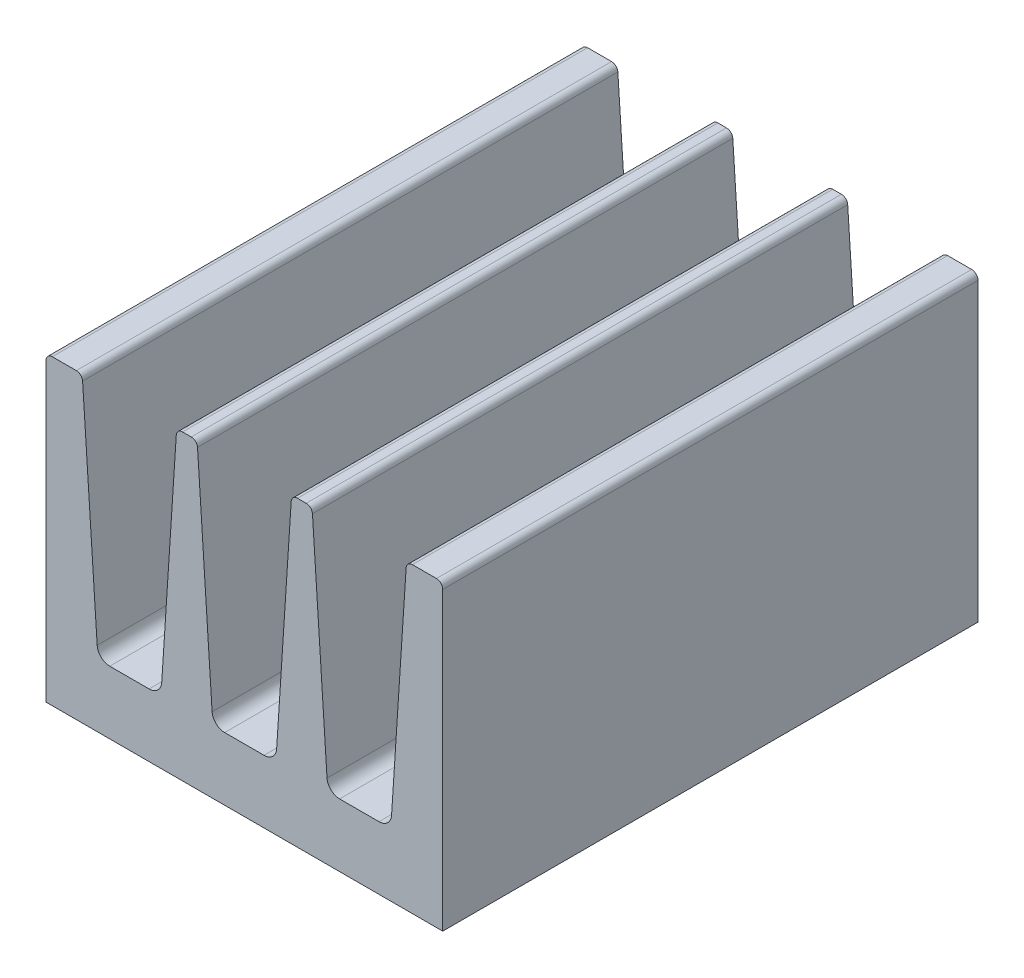
from build123d import *
from OCP.BRepFilletAPI import BRepFilletAPI_MakeChamfer

# Parameters (mm, degrees)
SKETCH1_W           = 6.3
SKETCH1_H           = 8.5
BOSS_EXTRUDE1_DEPTH = 4.8
SKETCH2_W           = 1
SKETCH2_H           = 8.5
CUT_EXTRUDE1_DEPTH  = 3.8
CHAMFER1_SIZE       = 3.8
CHAMFER1_SIZE_2     = 0.25
FILLET1_R           = 0.2
FILLET2_R           = 0.1


with BuildPart() as part:
    # Sketch1 → Boss-Extrude1 (new body)
    with BuildSketch(Plane(origin=(0, 0, 0), x_dir=(1, 0, 0), z_dir=(0, 1, 0))):
        with Locations((3.15, 4.25)):
            Rectangle(SKETCH1_W, SKETCH1_H)
    extrude(amount=BOSS_EXTRUDE1_DEPTH)

    # Sketch2 → Cut-Extrude1 (cut)
    with BuildSketch(Plane(origin=(0, 4.8, 0), x_dir=(1, 0, 0), z_dir=(0, 1, 0))):
        with Locations((1.325, 4.25)):
            Rectangle(SKETCH2_W, SKETCH2_H)
        with Locations((3.15, 4.25)):
            Rectangle(SKETCH2_W, SKETCH2_H)
        with Locations((4.975, 4.25)):
            Rectangle(SKETCH2_W, SKETCH2_H)
    extrude(amount=-CUT_EXTRUDE1_DEPTH, mode=Mode.SUBTRACT)

    # Chamfer1
    chamfer1_edges_1 = [part.edges().sort_by_distance(p)[0] for p in [
        (0.825, 4.8, -4.25),
    ]]
    chamfer1_side_1 = [part.faces().sort_by_distance(p)[0] for p in [
        (0.825, 4.795, -4.25),
    ]]
    chamfer1_edges_2 = [part.edges().sort_by_distance(p)[0] for p in [
        (5.475, 4.8, -4.25),
    ]]
    chamfer1_side_2 = [part.faces().sort_by_distance(p)[0] for p in [
        (5.48, 4.8, -4.25),
    ]]
    chamfer1_edges_3 = [part.edges().sort_by_distance(p)[0] for p in [
        (4.475, 4.8, -4.25),
    ]]
    chamfer1_side_3 = [part.faces().sort_by_distance(p)[0] for p in [
        (4.475, 4.795, -4.25),
    ]]
    chamfer1_edges_4 = [part.edges().sort_by_distance(p)[0] for p in [
        (3.65, 4.8, -4.25),
    ]]
    chamfer1_side_4 = [part.faces().sort_by_distance(p)[0] for p in [
        (3.655, 4.8, -4.25),
    ]]
    chamfer1_edges_5 = [part.edges().sort_by_distance(p)[0] for p in [
        (2.65, 4.8, -4.25),
    ]]
    chamfer1_side_5 = [part.faces().sort_by_distance(p)[0] for p in [
        (2.65, 4.795, -4.25),
    ]]
    chamfer1_edges_6 = [part.edges().sort_by_distance(p)[0] for p in [
        (1.825, 4.8, -4.25),
    ]]
    chamfer1_side_6 = [part.faces().sort_by_distance(p)[0] for p in [
        (1.83, 4.8, -4.25),
    ]]
    chamfer1 = BRepFilletAPI_MakeChamfer(part.part.solid().wrapped)
    for e in chamfer1_edges_1:
        chamfer1.Add(CHAMFER1_SIZE - 0.0001, CHAMFER1_SIZE_2 - 0.0001, e.wrapped, chamfer1_side_1[0].wrapped)
    for e in chamfer1_edges_2:
        chamfer1.Add(CHAMFER1_SIZE_2 - 0.0001, CHAMFER1_SIZE - 0.0001, e.wrapped, chamfer1_side_2[0].wrapped)
    for e in chamfer1_edges_3:
        chamfer1.Add(CHAMFER1_SIZE - 0.0001, CHAMFER1_SIZE_2 - 0.0001, e.wrapped, chamfer1_side_3[0].wrapped)
    for e in chamfer1_edges_4:
        chamfer1.Add(CHAMFER1_SIZE_2 - 0.0001, CHAMFER1_SIZE - 0.0001, e.wrapped, chamfer1_side_4[0].wrapped)
    for e in chamfer1_edges_5:
        chamfer1.Add(CHAMFER1_SIZE - 0.0001, CHAMFER1_SIZE_2 - 0.0001, e.wrapped, chamfer1_side_5[0].wrapped)
    for e in chamfer1_edges_6:
        chamfer1.Add(CHAMFER1_SIZE_2 - 0.0001, CHAMFER1_SIZE - 0.0001, e.wrapped, chamfer1_side_6[0].wrapped)
    add(Compound.cast(chamfer1.Shape()), mode=Mode.REPLACE)  # a hair under: the kernel refuses the full size

    # Fillet1
    fillet1_edges = [part.edges().sort_by_distance(p)[0] for p in [
        (0.825, 1, -4.25),
        (1.825, 1, -4.25),
        (2.65, 1, -4.25),
        (3.65, 1, -4.25),
        (4.475, 1, -4.25),
        (5.475, 1, -4.25),
    ]]
    fillet(fillet1_edges, radius=FILLET1_R)

    # Fillet2
    fillet2_edges = [part.edges().sort_by_distance(p)[0] for p in [
        (6.3, 4.8, -4.25),
        (0, 4.8, -4.25),
        (5.7249, 4.8, -4.25),
        (3.8999, 4.8, -4.25),
        (4.2251, 4.8, -4.25),
        (2.0749, 4.8, -4.25),
        (2.4001, 4.8, -4.25),
        (0.5751, 4.8, -4.25),
    ]]
    fillet(fillet2_edges, radius=FILLET2_R)


solid = part.part
